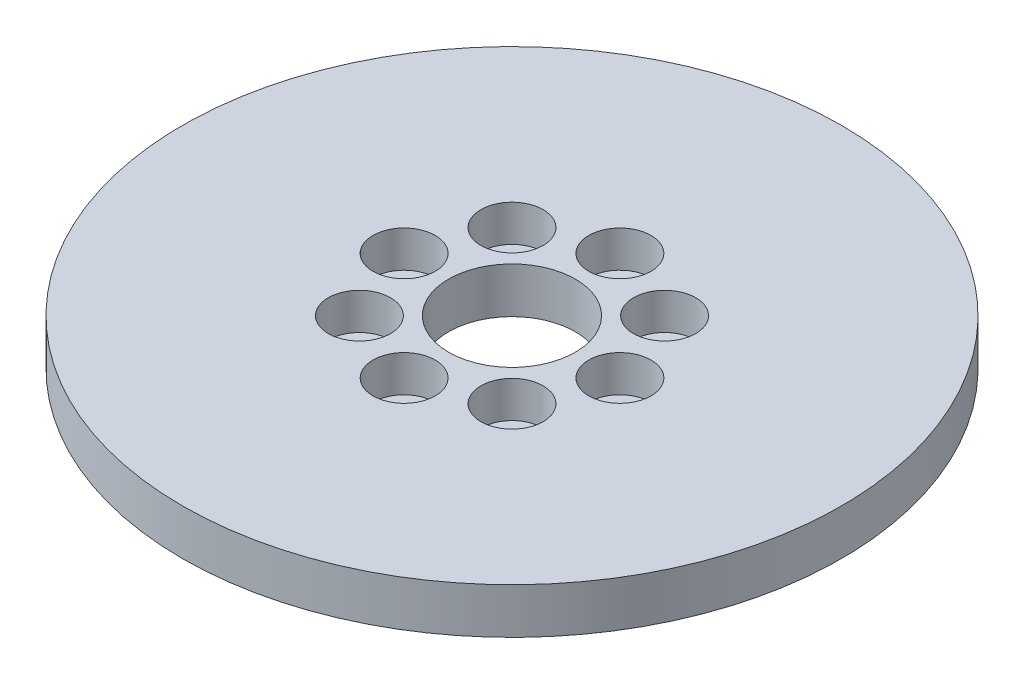
from build123d import *

# Parameters (mm, degrees)
SKETCH1_R           = 65
BOSS_EXTRUDE1_DEPTH = 9
SKETCH2_R           = 12.5
CUT_EXTRUDE1_DEPTH  = 93.36341267
SKETCH3_R           = 6.134029782
CUT_EXTRUDE2_DEPTH  = 7.21359781
CIRPATTERN1_COUNT   = 8


with BuildPart() as part:
    # Sketch1 → Boss-Extrude1 (new body)
    with BuildSketch(Plane(origin=(0, 0, 0), x_dir=(1, 0, 0), z_dir=(0, 1, 0))):
        Circle(SKETCH1_R)
    extrude(amount=BOSS_EXTRUDE1_DEPTH)

    # Sketch2 → Cut-Extrude1 (cut, through all)
    with BuildSketch(Plane(origin=(0, 0, 0), x_dir=(1, 0, 0), z_dir=(0, 1, 0))):
        Circle(SKETCH2_R)
    extrude(amount=CUT_EXTRUDE1_DEPTH, mode=Mode.SUBTRACT)

    # Sketch3 → Cut-Extrude2 (cut)
    with BuildSketch(Plane(origin=(0, 9, 0), x_dir=(1, 0, 0), z_dir=(0, 1, 0))):
        with Locations((-21.280059041, 0)):
            Circle(SKETCH3_R)
    cut_extrude2 = extrude(amount=-CUT_EXTRUDE2_DEPTH, mode=Mode.SUBTRACT)

    # CirPattern1: Cut-Extrude2 ×8 about axis
    cirpattern1_axis = Axis((0, 0, 0), (0, 1, 0))
    for i in range(1, CIRPATTERN1_COUNT):
        add(cut_extrude2.rotate(cirpattern1_axis, i * 360 / CIRPATTERN1_COUNT), mode=Mode.SUBTRACT)


solid = part.part
